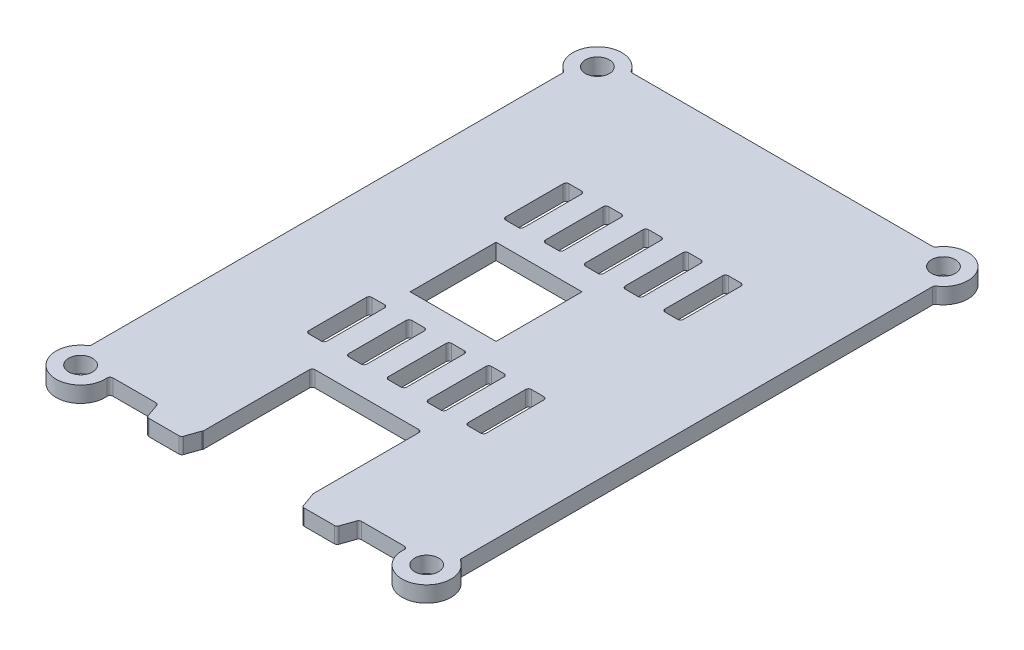
from build123d import *

# Parameters (mm, degrees)
BASEPLATE_OUTLINE_R = 2.1
BASEPLATE_DEPTH     = 2.8
CUT_EXTRUDE1_REACH  = 115.438
SKETCH3_W           = 19.2
SKETCH3_H           = 19.147905432
SKETCH3_W_2         = 15.1
SKETCH3_H_2         = 15.1
SKETCH3_W_3         = 3.2
SKETCH3_H_3         = 11.1
FILLET1_R           = 0.5


# Read off the part's stored shape, not the designer's step: BasePlate
with BuildPart() as part:
    # BasePlate outline → BasePlate (new body)
    with BuildSketch(Plane(origin=(0, 0, 0), x_dir=(1, 0, 0), z_dir=(0, 1, 0))):
        with BuildLine():
            Line((43.502626614, -5.852332608), (48.792614178, -5.852332608))
            ThreePointArc((48.792614178, -5.852332608), (49.082078508, -5.760021707), (49.264659986, -5.517174213))
            Line((49.264659986, -5.517174213), (50.078201202, -3.187491002))
            ThreePointArc((50.078201202, -3.187491002), (50.26078268, -2.944643509), (50.55024701, -2.852332608))
            Line((50.55024701, -2.852332608), (58.116695703, -2.852332608))
            ThreePointArc((58.116695703, -2.852332608), (58.484685739, -3.013831008), (58.614956567, -3.393999275))
            ThreePointArc((58.614956567, -3.393999275), (64.799237397, -7.61016844), (65.229166667, -0.137781095))
            ThreePointArc((65.229166667, -0.137781095), (65.061014427, 0.043158816), (65, 0.282515593))
            Line((65, 0.282515593), (65, 83.012819192))
            ThreePointArc((65, 83.012819192), (65.061014427, 83.252175969), (65.229166667, 83.433115879))
            ThreePointArc((65.229166667, 83.433115879), (65.940559159, 90.088226551), (59.285448487, 89.376834059))
            ThreePointArc((59.285448487, 89.376834059), (59.104508577, 89.208681819), (58.8651518, 89.147667392))
            Line((58.8651518, 89.147667392), (6.1348482, 89.147667392))
            ThreePointArc((6.1348482, 89.147667392), (5.895491423, 89.208681819), (5.714551513, 89.376834059))
            ThreePointArc((5.714551513, 89.376834059), (-0.940559159, 90.088226551), (-0.229166667, 83.433115879))
            ThreePointArc((-0.229166667, 83.433115879), (-0.061014427, 83.252175969), (0, 83.012819192))
            Line((0, 83.012819192), (0, 0.282515593))
            ThreePointArc((0, 0.282515593), (-0.061014427, 0.043158816), (-0.229166667, -0.137781095))
            ThreePointArc((-0.229166667, -0.137781095), (0.200762603, -7.61016844), (6.385043433, -3.393999275))
            ThreePointArc((6.385043433, -3.393999275), (6.515314261, -3.013831008), (6.883304297, -2.852332608))
            Line((6.883304297, -2.852332608), (14.44975299, -2.852332608))
            ThreePointArc((14.44975299, -2.852332608), (14.73921732, -2.944643509), (14.921798798, -3.187491002))
            Line((14.921798798, -3.187491002), (15.735340014, -5.517174213))
            ThreePointArc((15.735340014, -5.517174213), (15.917921492, -5.760021707), (16.207385822, -5.852332608))
            Line((16.207385822, -5.852332608), (21.497373386, -5.852332608))
            ThreePointArc((21.497373386, -5.852332608), (21.786837716, -5.760021707), (21.969419194, -5.517174213))
            Line((21.969419194, -5.517174213), (22.78296041, -3.187491002))
            ThreePointArc((22.78296041, -3.187491002), (22.965541888, -2.944643509), (23.255006218, -2.852332608))
            Line((23.255006218, -2.852332608), (41.744993782, -2.852332608))
            ThreePointArc((41.744993782, -2.852332608), (42.034458112, -2.944643509), (42.21703959, -3.187491002))
            Line((42.21703959, -3.187491002), (43.030580806, -5.517174213))
            ThreePointArc((43.030580806, -5.517174213), (43.213162284, -5.760021707), (43.502626614, -5.852332608))
        make_face()
        with Locations((2.1, -3.752332608)):
            Circle(BASEPLATE_OUTLINE_R, mode=Mode.SUBTRACT)
        with Locations((62.9, -3.752332608)):
            Circle(BASEPLATE_OUTLINE_R, mode=Mode.SUBTRACT)
        with Locations((2.1, 87.047667392)):
            Circle(BASEPLATE_OUTLINE_R, mode=Mode.SUBTRACT)
        with Locations((62.9, 87.047667392)):
            Circle(BASEPLATE_OUTLINE_R, mode=Mode.SUBTRACT)
    extrude(amount=BASEPLATE_DEPTH)

    # Sketch3 → Cut-Extrude1 (cut, up to next)
    with BuildSketch(Plane(origin=(0, 2.8, 0), x_dir=(1, 0, 0), z_dir=(0, 1, 0)), mode=Mode.PRIVATE) as cut_extrude1_sk1:
        with Locations((32.5, 6.573714676)):
            Rectangle(SKETCH3_W, SKETCH3_H)
    cut_extrude1_tool1 = extrude(cut_extrude1_sk1.sketch, amount=-CUT_EXTRUDE1_REACH, mode=Mode.PRIVATE) & part.part
    # Sketch3 → Cut-Extrude1 (cut, up to next)
    with BuildSketch(Plane(origin=(0, 2.8, 0), x_dir=(1, 0, 0), z_dir=(0, 1, 0)), mode=Mode.PRIVATE) as cut_extrude1_sk2:
        with Locations((27.45, 43.897667392)):
            Rectangle(SKETCH3_W_2, SKETCH3_H_2)
    cut_extrude1_tool2 = extrude(cut_extrude1_sk2.sketch, amount=-CUT_EXTRUDE1_REACH, mode=Mode.PRIVATE) & part.part
    # Sketch3 → Cut-Extrude1 (cut, up to next)
    with BuildSketch(Plane(origin=(0, 2.8, 0), x_dir=(1, 0, 0), z_dir=(0, 1, 0)), mode=Mode.PRIVATE) as cut_extrude1_sk3:
        with Locations((32.5, 26.597667392)):
            Rectangle(SKETCH3_W_3, SKETCH3_H_3)
    cut_extrude1_tool3 = extrude(cut_extrude1_sk3.sketch, amount=-CUT_EXTRUDE1_REACH, mode=Mode.PRIVATE) & part.part
    # Sketch3 → Cut-Extrude1 (cut, up to next)
    with BuildSketch(Plane(origin=(0, 2.8, 0), x_dir=(1, 0, 0), z_dir=(0, 1, 0)), mode=Mode.PRIVATE) as cut_extrude1_sk4:
        with Locations((18.5, 26.597667392)):
            Rectangle(SKETCH3_W_3, SKETCH3_H_3)
    cut_extrude1_tool4 = extrude(cut_extrude1_sk4.sketch, amount=-CUT_EXTRUDE1_REACH, mode=Mode.PRIVATE) & part.part
    # Sketch3 → Cut-Extrude1 (cut, up to next)
    with BuildSketch(Plane(origin=(0, 2.8, 0), x_dir=(1, 0, 0), z_dir=(0, 1, 0)), mode=Mode.PRIVATE) as cut_extrude1_sk5:
        with Locations((39.5, 26.597667392)):
            Rectangle(SKETCH3_W_3, SKETCH3_H_3)
    cut_extrude1_tool5 = extrude(cut_extrude1_sk5.sketch, amount=-CUT_EXTRUDE1_REACH, mode=Mode.PRIVATE) & part.part
    # Sketch3 → Cut-Extrude1 (cut, up to next)
    with BuildSketch(Plane(origin=(0, 2.8, 0), x_dir=(1, 0, 0), z_dir=(0, 1, 0)), mode=Mode.PRIVATE) as cut_extrude1_sk6:
        with Locations((46.5, 26.597667392)):
            Rectangle(SKETCH3_W_3, SKETCH3_H_3)
    cut_extrude1_tool6 = extrude(cut_extrude1_sk6.sketch, amount=-CUT_EXTRUDE1_REACH, mode=Mode.PRIVATE) & part.part
    # Sketch3 → Cut-Extrude1 (cut, up to next)
    with BuildSketch(Plane(origin=(0, 2.8, 0), x_dir=(1, 0, 0), z_dir=(0, 1, 0)), mode=Mode.PRIVATE) as cut_extrude1_sk7:
        with Locations((25.5, 26.597667392)):
            Rectangle(SKETCH3_W_3, SKETCH3_H_3)
    cut_extrude1_tool7 = extrude(cut_extrude1_sk7.sketch, amount=-CUT_EXTRUDE1_REACH, mode=Mode.PRIVATE) & part.part
    # Sketch3 → Cut-Extrude1 (cut, up to next)
    with BuildSketch(Plane(origin=(0, 2.8, 0), x_dir=(1, 0, 0), z_dir=(0, 1, 0)), mode=Mode.PRIVATE) as cut_extrude1_sk8:
        with Locations((18.5, 61.197667392)):
            Rectangle(SKETCH3_W_3, SKETCH3_H_3)
    cut_extrude1_tool8 = extrude(cut_extrude1_sk8.sketch, amount=-CUT_EXTRUDE1_REACH, mode=Mode.PRIVATE) & part.part
    # Sketch3 → Cut-Extrude1 (cut, up to next)
    with BuildSketch(Plane(origin=(0, 2.8, 0), x_dir=(1, 0, 0), z_dir=(0, 1, 0)), mode=Mode.PRIVATE) as cut_extrude1_sk9:
        with Locations((32.5, 61.197667392)):
            Rectangle(SKETCH3_W_3, SKETCH3_H_3)
    cut_extrude1_tool9 = extrude(cut_extrude1_sk9.sketch, amount=-CUT_EXTRUDE1_REACH, mode=Mode.PRIVATE) & part.part
    # Sketch3 → Cut-Extrude1 (cut, up to next)
    with BuildSketch(Plane(origin=(0, 2.8, 0), x_dir=(1, 0, 0), z_dir=(0, 1, 0)), mode=Mode.PRIVATE) as cut_extrude1_sk10:
        with Locations((39.5, 61.197667392)):
            Rectangle(SKETCH3_W_3, SKETCH3_H_3)
    cut_extrude1_tool10 = extrude(cut_extrude1_sk10.sketch, amount=-CUT_EXTRUDE1_REACH, mode=Mode.PRIVATE) & part.part
    # Sketch3 → Cut-Extrude1 (cut, up to next)
    with BuildSketch(Plane(origin=(0, 2.8, 0), x_dir=(1, 0, 0), z_dir=(0, 1, 0)), mode=Mode.PRIVATE) as cut_extrude1_sk11:
        with Locations((46.5, 61.197667392)):
            Rectangle(SKETCH3_W_3, SKETCH3_H_3)
    cut_extrude1_tool11 = extrude(cut_extrude1_sk11.sketch, amount=-CUT_EXTRUDE1_REACH, mode=Mode.PRIVATE) & part.part
    # Sketch3 → Cut-Extrude1 (cut, up to next)
    with BuildSketch(Plane(origin=(0, 2.8, 0), x_dir=(1, 0, 0), z_dir=(0, 1, 0)), mode=Mode.PRIVATE) as cut_extrude1_sk12:
        with Locations((25.5, 61.197667392)):
            Rectangle(SKETCH3_W_3, SKETCH3_H_3)
    cut_extrude1_tool12 = extrude(cut_extrude1_sk12.sketch, amount=-CUT_EXTRUDE1_REACH, mode=Mode.PRIVATE) & part.part
    add(cut_extrude1_tool1.solids().sort_by_distance((32.5, 2.8, -6.573715))[0], mode=Mode.SUBTRACT)
    add(cut_extrude1_tool2.solids().sort_by_distance((27.45, 2.8, -43.897667))[0], mode=Mode.SUBTRACT)
    add(cut_extrude1_tool3.solids().sort_by_distance((32.5, 2.8, -26.597667))[0], mode=Mode.SUBTRACT)
    add(cut_extrude1_tool4.solids().sort_by_distance((18.5, 2.8, -26.597667))[0], mode=Mode.SUBTRACT)
    add(cut_extrude1_tool5.solids().sort_by_distance((39.5, 2.8, -26.597667))[0], mode=Mode.SUBTRACT)
    add(cut_extrude1_tool6.solids().sort_by_distance((46.5, 2.8, -26.597667))[0], mode=Mode.SUBTRACT)
    add(cut_extrude1_tool7.solids().sort_by_distance((25.5, 2.8, -26.597667))[0], mode=Mode.SUBTRACT)
    add(cut_extrude1_tool8.solids().sort_by_distance((18.5, 2.8, -61.197667))[0], mode=Mode.SUBTRACT)
    add(cut_extrude1_tool9.solids().sort_by_distance((32.5, 2.8, -61.197667))[0], mode=Mode.SUBTRACT)
    add(cut_extrude1_tool10.solids().sort_by_distance((39.5, 2.8, -61.197667))[0], mode=Mode.SUBTRACT)
    add(cut_extrude1_tool11.solids().sort_by_distance((46.5, 2.8, -61.197667))[0], mode=Mode.SUBTRACT)
    add(cut_extrude1_tool12.solids().sort_by_distance((25.5, 2.8, -61.197667))[0], mode=Mode.SUBTRACT)

    # Fillet1
    fillet1_edges = [part.edges().sort_by_distance(p)[0] for p in [
        (22.9, 1.4, -16.147667392),
        (42.1, 1.4, -16.147667392),
        (37.9, 1.4, -55.647667392),
        (37.9, 1.4, -66.747667392),
        (41.1, 1.4, -66.747667392),
        (41.1, 1.4, -55.647667392),
        (16.9, 1.4, -66.747667392),
        (20.1, 1.4, -66.747667392),
        (20.1, 1.4, -55.647667392),
        (16.9, 1.4, -55.647667392),
        (27.1, 1.4, -66.747667392),
        (27.1, 1.4, -55.647667392),
        (23.9, 1.4, -55.647667392),
        (23.9, 1.4, -66.747667392),
        (30.9, 1.4, -21.047667392),
        (30.9, 1.4, -32.147667392),
        (34.1, 1.4, -32.147667392),
        (34.1, 1.4, -21.047667392),
        (44.9, 1.4, -21.047667392),
        (44.9, 1.4, -32.147667392),
        (48.1, 1.4, -32.147667392),
        (48.1, 1.4, -21.047667392),
        (37.9, 1.4, -21.047667392),
        (37.9, 1.4, -32.147667392),
        (41.1, 1.4, -32.147667392),
        (41.1, 1.4, -21.047667392),
        (16.9, 1.4, -32.147667392),
        (20.1, 1.4, -32.147667392),
        (20.1, 1.4, -21.047667392),
        (16.9, 1.4, -21.047667392),
        (27.1, 1.4, -32.147667392),
        (27.1, 1.4, -21.047667392),
        (23.9, 1.4, -21.047667392),
        (23.9, 1.4, -32.147667392),
        (30.9, 1.4, -55.647667392),
        (30.9, 1.4, -66.747667392),
        (34.1, 1.4, -66.747667392),
        (34.1, 1.4, -55.647667392),
        (44.9, 1.4, -55.647667392),
        (44.9, 1.4, -66.747667392),
        (48.1, 1.4, -66.747667392),
        (48.1, 1.4, -55.647667392),
    ]]
    fillet(fillet1_edges, radius=FILLET1_R)


solid = part.part
